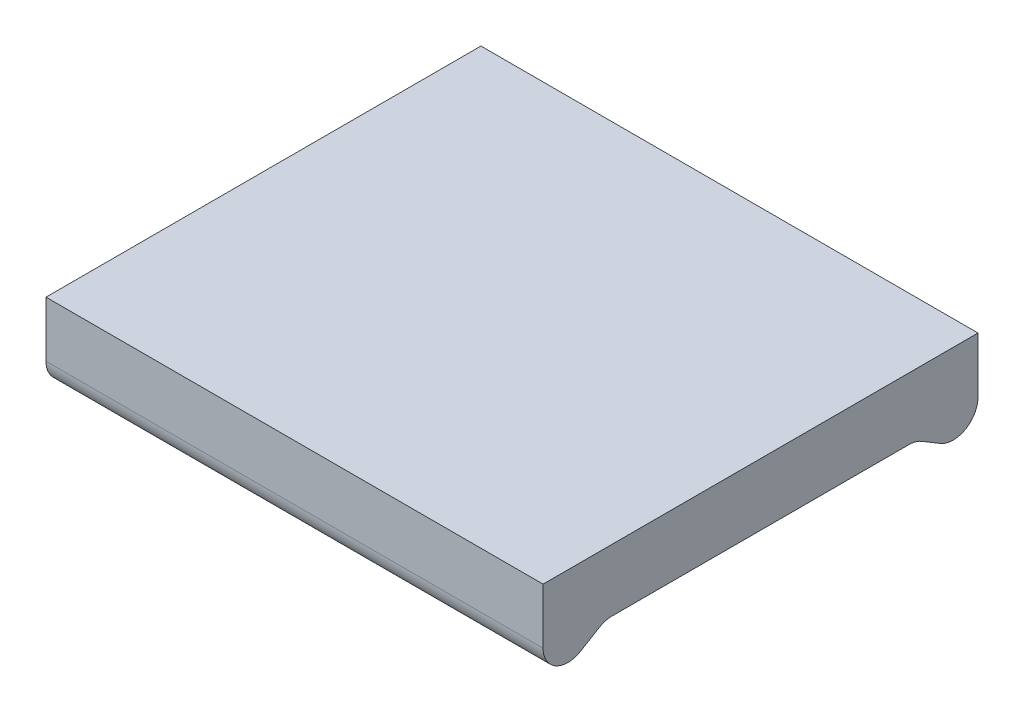
from build123d import *

# Parameters (mm, degrees)
SKETCH1_W               = 40
SKETCH1_H               = 35
BOSS_EXTRUDE1_DEPTH     = 8
CUT_EXTRUDE1_DEPTH      = 45.38749824
CUT_EXTRUDE1_DEPTH_BACK = 45.38749824
FILLET1_R               = 2


with BuildPart() as part:
    # Sketch1 → Boss-Extrude1 (new body)
    with BuildSketch(Plane(origin=(0, 0, 0), x_dir=(1, 0, 0), z_dir=(0, 1, 0))):
        Rectangle(SKETCH1_W, SKETCH1_H)
    extrude(amount=-BOSS_EXTRUDE1_DEPTH)

    # Sketch2 → Cut-Extrude1 (cut, two sides: drawn at the far end of the back side and taken through both)
    with BuildSketch(Plane(origin=(20, 0, 0), x_dir=(0, 0, -1), z_dir=(1, 0, 0)).offset(-CUT_EXTRUDE1_DEPTH_BACK)):
        Polygon((-12.5, -5), (-17.5, -8), (17.5, -8), (12.5, -5), align=None)
    extrude(amount=CUT_EXTRUDE1_DEPTH + CUT_EXTRUDE1_DEPTH_BACK, mode=Mode.SUBTRACT)

    # Fillet1
    fillet1_edges = [part.edges().sort_by_distance(p)[0] for p in [
        (0, -5, 12.5),
        (0, -5, -12.5),
        (0, -8, -17.5),
        (0, -8, 17.5),
    ]]
    fillet(fillet1_edges, radius=FILLET1_R)


solid = part.part
